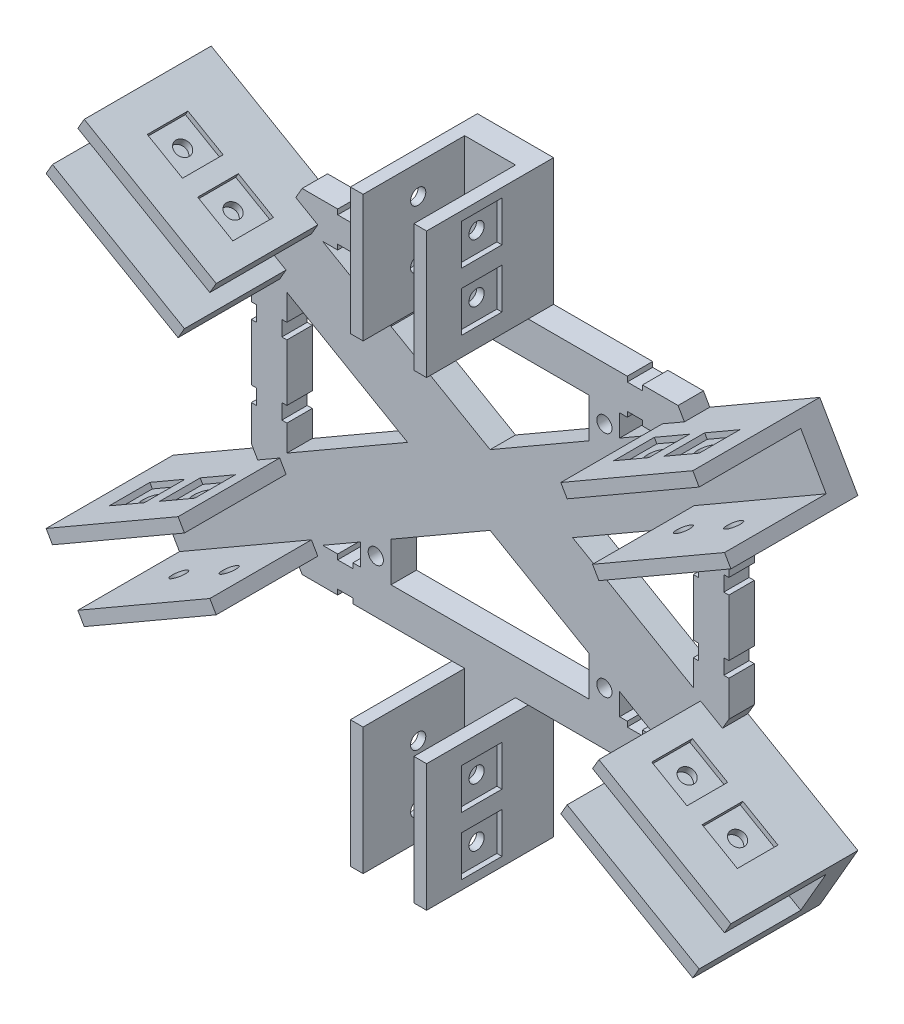
from build123d import *

# Parameters (mm, degrees)
ESQUISSE1_R                = 1.5
BOSS_EXTRU_2_DEPTH         = 5
ENL_V_MAT_EXTRU_2_DEPTH    = 2
ESQUISSE5_W                = 20
ESQUISSE5_H                = 2.5
BOSS_EXTRU_3_DEPTH         = 30
ESQUISSE7_W                = 20
ESQUISSE7_H                = 2.5
BOSS_EXTRU_4_DEPTH         = 30
ESQUISSE8_W                = 8
ESQUISSE8_H                = 8
ENL_V_MAT_EXTRU_3_DEPTH    = 1
ESQUISSE9_W                = 8
ESQUISSE9_H                = 8
ENL_V_MAT_EXTRU_4_DEPTH    = 1
ESQUISSE10_R               = 1.5
ENL_V_MAT_EXTRU_5_DEPTH    = 3
SYM_TRIE5_COPY_1_SKETCH_R  = 1.5
SYM_TRIE5_COPY_1_DEPTH     = 3
SYM_TRIE7_COPY_1_SKETCH_R  = 1.5
SYM_TRIE7_COPY_1_DEPTH     = 3
SYM_TRIE7_COPY_2_SKETCH_W  = 8
SYM_TRIE7_COPY_2_SKETCH_H  = 8
SYM_TRIE7_COPY_2_DEPTH     = 1
SYM_TRIE7_COPY_3_SKETCH_W  = 8
SYM_TRIE7_COPY_3_SKETCH_H  = 8
SYM_TRIE7_COPY_3_DEPTH     = 1
SYM_TRIE7_COPY_4_SKETCH_R  = 1.5
SYM_TRIE7_COPY_4_DEPTH     = 3
SYM_TRIE7_COPY_5_SKETCH_R  = 1.5
SYM_TRIE7_COPY_5_DEPTH     = 3
SYM_TRIE8_COPY_1_SKETCH_R  = 1.5
SYM_TRIE8_COPY_1_DEPTH     = 3
SYM_TRIE8_COPY_2_SKETCH_W  = 8
SYM_TRIE8_COPY_2_SKETCH_H  = 8
SYM_TRIE8_COPY_2_DEPTH     = 1
SYM_TRIE8_COPY_3_SKETCH_W  = 8
SYM_TRIE8_COPY_3_SKETCH_H  = 8
SYM_TRIE8_COPY_3_DEPTH     = 1
SYM_TRIE8_COPY_4_SKETCH_R  = 1.5
SYM_TRIE8_COPY_4_DEPTH     = 3
SYM_TRIE8_COPY_5_SKETCH_R  = 1.5
SYM_TRIE8_COPY_5_DEPTH     = 3
SYM_TRIE8_COPY_6_SKETCH_W  = 20
SYM_TRIE8_COPY_6_SKETCH_H  = 2.5
SYM_TRIE8_COPY_6_DEPTH     = 30
SYM_TRIE8_COPY_7_SKETCH_W  = 20
SYM_TRIE8_COPY_7_SKETCH_H  = 2.5
SYM_TRIE8_COPY_7_DEPTH     = 30
SYM_TRIE8_COPY_8_SKETCH_W  = 8
SYM_TRIE8_COPY_8_SKETCH_H  = 8
SYM_TRIE8_COPY_8_DEPTH     = 1
SYM_TRIE8_COPY_9_SKETCH_W  = 8
SYM_TRIE8_COPY_9_SKETCH_H  = 8
SYM_TRIE8_COPY_9_DEPTH     = 1
SYM_TRIE8_COPY_10_SKETCH_R = 1.5
SYM_TRIE8_COPY_10_DEPTH    = 3
SYM_TRIE8_COPY_11_SKETCH_R = 1.5
SYM_TRIE8_COPY_11_DEPTH    = 3
SYM_TRIE8_COPY_12_SKETCH_W = 8
SYM_TRIE8_COPY_12_SKETCH_H = 8
SYM_TRIE8_COPY_12_DEPTH    = 1
SYM_TRIE8_COPY_13_SKETCH_W = 8
SYM_TRIE8_COPY_13_SKETCH_H = 8
SYM_TRIE8_COPY_13_DEPTH    = 1
SYM_TRIE8_COPY_14_SKETCH_R = 1.5
SYM_TRIE8_COPY_14_DEPTH    = 3
SYM_TRIE8_COPY_15_SKETCH_R = 1.5
SYM_TRIE8_COPY_15_DEPTH    = 3
ESQUISSE11_W               = 2.5
ESQUISSE11_H               = 20
BOSS_EXTRU_5_DEPTH         = 25
ESQUISSE50_W               = 8
ESQUISSE50_H               = 8
ENL_V_MAT_EXTRU_25_DEPTH   = 1
ESQUISSE52_W               = 8
ESQUISSE52_H               = 8
ENL_V_MAT_EXTRU_26_DEPTH   = 1
ESQUISSE54_R               = 1.5
ENL_V_MAT_EXTRU_27_DEPTH   = 3
SYM_TRIE10_COPY_1_SKETCH_R = 1.5
SYM_TRIE10_COPY_1_DEPTH    = 3
SYM_TRIE11_COPY_1_SKETCH_R = 1.5
SYM_TRIE11_COPY_1_DEPTH    = 3
SYM_TRIE11_COPY_2_SKETCH_W = 2.5
SYM_TRIE11_COPY_2_SKETCH_H = 20
SYM_TRIE11_COPY_2_DEPTH    = 25
SYM_TRIE11_COPY_3_SKETCH_W = 8
SYM_TRIE11_COPY_3_SKETCH_H = 8
SYM_TRIE11_COPY_3_DEPTH    = 1
SYM_TRIE11_COPY_4_SKETCH_W = 8
SYM_TRIE11_COPY_4_SKETCH_H = 8
SYM_TRIE11_COPY_4_DEPTH    = 1
SYM_TRIE11_COPY_5_SKETCH_R = 1.5
SYM_TRIE11_COPY_5_DEPTH    = 3
SYM_TRIE11_COPY_6_SKETCH_R = 1.5
SYM_TRIE11_COPY_6_DEPTH    = 3


with BuildPart() as part:
    # Esquisse1 → Boss.-Extru.2 (new body)
    with BuildSketch(Plane.XY):
        Polygon((-27, -32.908965344), (-27, -31.908965344), (-30, -31.908965344), (-30, -32.908965344), (-37, -32.908965344), (-38.250062729, -30.743793185), (-59.900697824, -43.243793185), (-67.400697824, -30.253412128), (-45.750062729, -17.753412128), (-47, -15.588457268), (-47, -8.588457268), (-46, -8.588457268), (-46, -5.588457268), (-47, -5.588457268), (-47, 5.588457268), (-46, 5.588457268), (-46, 8.588457268), (-47, 8.588457268), (-47, 15.588457268), (-45.750062729, 17.753412128), (-67.400697824, 30.253412128), (-59.900697824, 43.243793185), (-38.250062729, 30.743793185), (-37, 32.908965344), (-30, 32.908965344), (-30, 31.908965344), (-27, 31.908965344), (-27, 32.908965344), (-7.5, 32.908965344), (-7.5, 57.908965344), (7.5, 57.908965344), (7.5, 32.908965344), (27, 32.908965344), (27, 31.908965344), (30, 31.908965344), (30, 32.908965344), (37, 32.908965344), (38.250062729, 30.743793185), (59.900697824, 43.243793185), (67.400697824, 30.253412128), (45.750062729, 17.753412128), (47, 15.588457268), (47, 8.588457268), (46, 8.588457268), (46, 5.588457268), (47, 5.588457268), (47, -5.588457268), (46, -5.588457268), (46, -8.588457268), (47, -8.588457268), (47, -15.588457268), (45.750062729, -17.753412128), (67.400697824, -30.253412128), (59.900697824, -43.243793185), (38.250062729, -30.743793185), (37, -32.908965344), (30, -32.908965344), (30, -31.908965344), (27, -31.908965344), (27, -32.908965344), (7.5, -32.908965344), (7.5, -57.908965344), (-7.5, -57.908965344), (-7.5, -32.908965344), align=None)
        with Locations((22.5, 22.5)):
            Circle(ESQUISSE1_R, mode=Mode.SUBTRACT)
        with Locations((-22.5, 22.5)):
            Circle(ESQUISSE1_R, mode=Mode.SUBTRACT)
        with Locations((22.5, -22.5)):
            Circle(ESQUISSE1_R, mode=Mode.SUBTRACT)
        with Locations((-22.5, -22.5)):
            Circle(ESQUISSE1_R, mode=Mode.SUBTRACT)
        Polygon((-40, 5.588457268), (-40, -5.588457268), (-41, -5.588457268), (-41, -8.588457268), (-40, -8.588457268), (-40, -13.712812921), (-16.248711306, 0), (-40, 13.712812921), (-40, 8.588457268), (-41, 8.588457268), (-41, 5.588457268), align=None, mode=Mode.SUBTRACT)
        Polygon((40, 13.712812921), (16.248711306, 0), (40, -13.712812921), (40, -8.588457268), (41, -8.588457268), (41, -5.588457268), (40, -5.588457268), (40, 5.588457268), (41, 5.588457268), (41, 8.588457268), (40, 8.588457268), align=None, mode=Mode.SUBTRACT)
        Polygon((-32.958548116, -25.908965344), (-30, -25.908965344), (-30, -26.908965344), (-27, -26.908965344), (-27, -25.908965344), (-25.5, -25.908965344), (-25.5, -21.602770581), align=None, mode=Mode.SUBTRACT)
        Polygon((19.5, -25.908965344), (0, -25.908965344), (-19.5, -25.908965344), (-19.5, -18.138668966), (0, -6.880338717), (19.5, -18.138668966), align=None, mode=Mode.SUBTRACT)
        Polygon((-27, 26.908965344), (-27, 25.908965344), (-25.5, 25.908965344), (-25.5, 21.602770581), (-32.958548116, 25.908965344), (-30, 25.908965344), (-30, 26.908965344), align=None, mode=Mode.SUBTRACT)
        Polygon((32.958548116, 25.908965344), (25.5, 21.602770581), (25.5, 25.908965344), (27, 25.908965344), (27, 26.908965344), (30, 26.908965344), (30, 25.908965344), align=None, mode=Mode.SUBTRACT)
        Polygon((27, -26.908965344), (27, -25.908965344), (25.5, -25.908965344), (25.5, -21.602770581), (32.958548116, -25.908965344), (30, -25.908965344), (30, -26.908965344), align=None, mode=Mode.SUBTRACT)
        Polygon((-19.5, 25.908965344), (-19.5, 18.138668966), (0, 6.880338717), (19.5, 18.138668966), (19.5, 25.908965344), (0, 25.908965344), align=None, mode=Mode.SUBTRACT)
    extrude(amount=BOSS_EXTRU_2_DEPTH)

    # Esquisse4 → Enlèv. mat.-Extru.2 (cut)
    with BuildSketch(Plane(origin=(0, 0, 0), x_dir=(-1, 0, 0), z_dir=(0, 0, -1))):
        Polygon((-22.5, 20.142891012), (-20.458683737, 21.321445506), (-20.458683737, 23.678554494), (-22.5, 24.857108988), (-24.541316263, 23.678554494), (-24.541316263, 21.321445506), align=None)
        Polygon((24.541316263, 21.321445506), (22.5, 20.142891012), (20.458683737, 21.321445506), (20.458683737, 23.678554494), (22.5, 24.857108988), (24.541316263, 23.678554494), align=None)
        Polygon((22.5, -20.142891012), (20.458683737, -21.321445506), (20.458683737, -23.678554494), (22.5, -24.857108988), (24.541316263, -23.678554494), (24.541316263, -21.321445506), align=None)
        Polygon((-24.541316263, -21.321445506), (-22.5, -20.142891012), (-20.458683737, -21.321445506), (-20.458683737, -23.678554494), (-22.5, -24.857108988), (-24.541316263, -23.678554494), align=None)
    extrude(amount=-ENL_V_MAT_EXTRU_2_DEPTH, mode=Mode.SUBTRACT)

    # Esquisse5 → Boss.-Extru.3 (add)
    with BuildSketch(Plane(origin=(63.650635095, 36.748711306, 0), x_dir=(0, 0, -1), z_dir=(0.8660254037844382, 0.500000000000001, 0))):
        with Locations((-15, -6.250125458)):
            Rectangle(ESQUISSE5_W, ESQUISSE5_H)
    boss_extru_3 = extrude(amount=-BOSS_EXTRU_3_DEPTH)

    # Esquisse7 → Boss.-Extru.4 (add)
    with BuildSketch(Plane(origin=(63.650635095, 36.748711306, 0), x_dir=(0, 0, -1), z_dir=(0.866025403784438, 0.5000000000000009, 0))):
        with Locations((-15, 6.249874542)):
            Rectangle(ESQUISSE7_W, ESQUISSE7_H)
    boss_extru_4 = extrude(amount=-BOSS_EXTRU_4_DEPTH)

    # Esquisse8 → Enlèv. mat.-Extru.3 (cut)
    with BuildSketch(Plane(origin=(3.750062729, -6.495299178, 0), x_dir=(0.8660254037844448, 0.4999999999999891, 0), z_dir=(0.4999999999999892, -0.8660254037844449, 0))):
        with Locations((51.610954886, 14.155470703)):
            Rectangle(ESQUISSE8_W, ESQUISSE8_H)
    enl_v_mat_extru_3 = extrude(amount=-ENL_V_MAT_EXTRU_3_DEPTH, mode=Mode.SUBTRACT)

    # Esquisse9 → Enlèv. mat.-Extru.4 (cut)
    with BuildSketch(Plane(origin=(3.750062729, -6.495299178, 0), x_dir=(0.8660254037844448, 0.4999999999999891, 0), z_dir=(0.4999999999999892, -0.8660254037844449, 0))):
        with Locations((63.062795122, 14.155470703)):
            Rectangle(ESQUISSE9_W, ESQUISSE9_H)
    enl_v_mat_extru_4 = extrude(amount=-ENL_V_MAT_EXTRU_4_DEPTH, mode=Mode.SUBTRACT)

    # Esquisse10 → Enlèv. mat.-Extru.5 (cut)
    with BuildSketch(Plane(origin=(3.250062729, -5.629273774, 0), x_dir=(0.8660254037844448, 0.49999999999998934, 0), z_dir=(0.4999999999999894, -0.8660254037844449, 0))):
        with Locations((51.610954886, 14.155470703)):
            Circle(ESQUISSE10_R)
    enl_v_mat_extru_5 = extrude(amount=-ENL_V_MAT_EXTRU_5_DEPTH, mode=Mode.SUBTRACT)

    # Symétrie4: Enlèv. mat.-Extru.5 across plane
    add(enl_v_mat_extru_5.mirror(Plane(origin=(49.655190327, 28.668437502, 0), x_dir=(0, 0, 1), z_dir=(-0.8660254037844448, -0.4999999999999891, 0))), mode=Mode.SUBTRACT)

    # Symétrie5: Enlèv. mat.-Extru.3, Enlèv. mat.-Extru.4, Enlèv. mat.-Extru.5 across plane
    add(enl_v_mat_extru_3.mirror(Plane(origin=(6.2729e-05, -0.00010865, 0), x_dir=(0, 0, 1), z_dir=(-0.5000000000000009, 0.8660254037844383, 0))), mode=Mode.SUBTRACT)
    add(enl_v_mat_extru_4.mirror(Plane(origin=(6.2729e-05, -0.00010865, 0), x_dir=(0, 0, 1), z_dir=(-0.5000000000000009, 0.8660254037844383, 0))), mode=Mode.SUBTRACT)
    add(enl_v_mat_extru_5.mirror(Plane(origin=(6.2729e-05, -0.00010865, 0), x_dir=(0, 0, 1), z_dir=(-0.5000000000000009, 0.8660254037844383, 0))), mode=Mode.SUBTRACT)

    # Symétrie5 copy 1 sketch → Symétrie5 copy 1 (cut)
    with BuildSketch(Plane(origin=(96.060443383, 62.965931479, 0), x_dir=(-0.8660254037844315, -0.5000000000000128, 1.001543065824766e-15), z_dir=(-0.500000000000013, 0.8660254037844318, 0))):
        with Locations((51.610954886, 14.155470703)):
            Circle(SYM_TRIE5_COPY_1_SKETCH_R)
    extrude(amount=-SYM_TRIE5_COPY_1_DEPTH, mode=Mode.SUBTRACT)

    # Symétrie7: Boss.-Extru.3, Boss.-Extru.4, Enlèv. mat.-Extru.3, Enlèv. mat.-Extru.4, Enlèv. mat.-Extru.5 across plane
    add(boss_extru_3.mirror(Plane.ZX))
    add(boss_extru_4.mirror(Plane.ZX))
    add(enl_v_mat_extru_3.mirror(Plane.ZX), mode=Mode.SUBTRACT)
    add(enl_v_mat_extru_4.mirror(Plane.ZX), mode=Mode.SUBTRACT)
    add(enl_v_mat_extru_5.mirror(Plane.ZX), mode=Mode.SUBTRACT)

    # Symétrie7 copy 1 sketch → Symétrie7 copy 1 (cut)
    with BuildSketch(Plane(origin=(102.560443383, -51.70760123, 0), x_dir=(-0.866025403784445, 0.49999999999998906, 1.001543065824766e-15), z_dir=(0.4999999999999891, 0.8660254037844451, 0))):
        with Locations((51.610954886, 14.155470703)):
            Circle(SYM_TRIE7_COPY_1_SKETCH_R)
    extrude(amount=-SYM_TRIE7_COPY_1_DEPTH, mode=Mode.SUBTRACT)

    # Symétrie7 copy 2 sketch → Symétrie7 copy 2 (cut)
    with BuildSketch(Plane(origin=(-3.749937271, -6.495081879, 0), x_dir=(0.8660254037844313, -0.5000000000000124, 0), z_dir=(-0.5000000000000128, -0.8660254037844318, 0))):
        with Locations((51.610954886, 14.155470703)):
            Rectangle(SYM_TRIE7_COPY_2_SKETCH_W, SYM_TRIE7_COPY_2_SKETCH_H)
    extrude(amount=-SYM_TRIE7_COPY_2_DEPTH, mode=Mode.SUBTRACT)

    # Symétrie7 copy 3 sketch → Symétrie7 copy 3 (cut)
    with BuildSketch(Plane(origin=(-3.749937271, -6.495081879, 0), x_dir=(0.8660254037844313, -0.5000000000000124, 0), z_dir=(-0.5000000000000128, -0.8660254037844318, 0))):
        with Locations((63.062795122, 14.155470703)):
            Rectangle(SYM_TRIE7_COPY_3_SKETCH_W, SYM_TRIE7_COPY_3_SKETCH_H)
    extrude(amount=-SYM_TRIE7_COPY_3_DEPTH, mode=Mode.SUBTRACT)

    # Symétrie7 copy 4 sketch → Symétrie7 copy 4 (cut)
    with BuildSketch(Plane(origin=(-3.249937271, -5.629056475, 0), x_dir=(0.8660254037844315, -0.5000000000000123, 0), z_dir=(-0.5000000000000127, -0.866025403784432, 0))):
        with Locations((51.610954886, 14.155470703)):
            Circle(SYM_TRIE7_COPY_4_SKETCH_R)
    extrude(amount=-SYM_TRIE7_COPY_4_DEPTH, mode=Mode.SUBTRACT)

    # Symétrie7 copy 5 sketch → Symétrie7 copy 5 (cut)
    with BuildSketch(Plane(origin=(96.060443383, -62.965931479, 0), x_dir=(-0.8660254037844315, 0.5000000000000128, 1.001543065824766e-15), z_dir=(-0.500000000000013, -0.8660254037844318, 0))):
        with Locations((51.610954886, -14.155470703)):
            Circle(SYM_TRIE7_COPY_5_SKETCH_R)
    extrude(amount=-SYM_TRIE7_COPY_5_DEPTH, mode=Mode.SUBTRACT)

    # Symétrie8: Boss.-Extru.3, Boss.-Extru.4, Enlèv. mat.-Extru.3, Enlèv. mat.-Extru.4, Enlèv. mat.-Extru.5 across plane
    add(boss_extru_3.mirror(Plane(origin=(0, 0, 0), x_dir=(0, 0, 1), z_dir=(1, 0, 0))))
    add(boss_extru_4.mirror(Plane(origin=(0, 0, 0), x_dir=(0, 0, 1), z_dir=(1, 0, 0))))
    add(enl_v_mat_extru_3.mirror(Plane(origin=(0, 0, 0), x_dir=(0, 0, 1), z_dir=(1, 0, 0))), mode=Mode.SUBTRACT)
    add(enl_v_mat_extru_4.mirror(Plane(origin=(0, 0, 0), x_dir=(0, 0, 1), z_dir=(1, 0, 0))), mode=Mode.SUBTRACT)
    add(enl_v_mat_extru_5.mirror(Plane(origin=(0, 0, 0), x_dir=(0, 0, 1), z_dir=(1, 0, 0))), mode=Mode.SUBTRACT)

    # Symétrie8 copy 1 sketch → Symétrie8 copy 1 (cut)
    with BuildSketch(Plane(origin=(-102.560443383, 51.70760123, 0), x_dir=(0.866025403784445, -0.49999999999998906, 1.001543065824766e-15), z_dir=(-0.4999999999999891, -0.8660254037844451, 0))):
        with Locations((51.610954886, 14.155470703)):
            Circle(SYM_TRIE8_COPY_1_SKETCH_R)
    extrude(amount=-SYM_TRIE8_COPY_1_DEPTH, mode=Mode.SUBTRACT)

    # Symétrie8 copy 2 sketch → Symétrie8 copy 2 (cut)
    with BuildSketch(Plane(origin=(3.749937271, 6.495081879, 0), x_dir=(-0.8660254037844313, 0.5000000000000124, 0), z_dir=(0.5000000000000128, 0.8660254037844318, 0))):
        with Locations((51.610954886, 14.155470703)):
            Rectangle(SYM_TRIE8_COPY_2_SKETCH_W, SYM_TRIE8_COPY_2_SKETCH_H)
    extrude(amount=-SYM_TRIE8_COPY_2_DEPTH, mode=Mode.SUBTRACT)

    # Symétrie8 copy 3 sketch → Symétrie8 copy 3 (cut)
    with BuildSketch(Plane(origin=(3.749937271, 6.495081879, 0), x_dir=(-0.8660254037844313, 0.5000000000000124, 0), z_dir=(0.5000000000000128, 0.8660254037844318, 0))):
        with Locations((63.062795122, 14.155470703)):
            Rectangle(SYM_TRIE8_COPY_3_SKETCH_W, SYM_TRIE8_COPY_3_SKETCH_H)
    extrude(amount=-SYM_TRIE8_COPY_3_DEPTH, mode=Mode.SUBTRACT)

    # Symétrie8 copy 4 sketch → Symétrie8 copy 4 (cut)
    with BuildSketch(Plane(origin=(3.249937271, 5.629056475, 0), x_dir=(-0.8660254037844315, 0.5000000000000123, 0), z_dir=(0.5000000000000127, 0.866025403784432, 0))):
        with Locations((51.610954886, 14.155470703)):
            Circle(SYM_TRIE8_COPY_4_SKETCH_R)
    extrude(amount=-SYM_TRIE8_COPY_4_DEPTH, mode=Mode.SUBTRACT)

    # Symétrie8 copy 5 sketch → Symétrie8 copy 5 (cut)
    with BuildSketch(Plane(origin=(-96.060443383, 62.965931479, 0), x_dir=(0.8660254037844315, -0.5000000000000128, 1.001543065824766e-15), z_dir=(0.500000000000013, 0.8660254037844318, 0))):
        with Locations((51.610954886, -14.155470703)):
            Circle(SYM_TRIE8_COPY_5_SKETCH_R)
    extrude(amount=-SYM_TRIE8_COPY_5_DEPTH, mode=Mode.SUBTRACT)

    # Symétrie8 copy 6 sketch → Symétrie8 copy 6 (add)
    with BuildSketch(Plane(origin=(-63.650635095, -36.748711306, 0), x_dir=(0, 0, -1), z_dir=(-0.8660254037844382, -0.500000000000001, 0))):
        with Locations((-15, -6.250125458)):
            Rectangle(SYM_TRIE8_COPY_6_SKETCH_W, SYM_TRIE8_COPY_6_SKETCH_H)
    extrude(amount=-SYM_TRIE8_COPY_6_DEPTH)

    # Symétrie8 copy 7 sketch → Symétrie8 copy 7 (add)
    with BuildSketch(Plane(origin=(-63.650635095, -36.748711306, 0), x_dir=(0, 0, -1), z_dir=(-0.866025403784438, -0.5000000000000009, 0))):
        with Locations((-15, 6.249874542)):
            Rectangle(SYM_TRIE8_COPY_7_SKETCH_W, SYM_TRIE8_COPY_7_SKETCH_H)
    extrude(amount=-SYM_TRIE8_COPY_7_DEPTH)

    # Symétrie8 copy 8 sketch → Symétrie8 copy 8 (cut)
    with BuildSketch(Plane(origin=(-3.750062729, 6.495299178, 0), x_dir=(-0.8660254037844448, -0.4999999999999891, 0), z_dir=(-0.4999999999999892, 0.8660254037844449, 0))):
        with Locations((51.610954886, 14.155470703)):
            Rectangle(SYM_TRIE8_COPY_8_SKETCH_W, SYM_TRIE8_COPY_8_SKETCH_H)
    extrude(amount=-SYM_TRIE8_COPY_8_DEPTH, mode=Mode.SUBTRACT)

    # Symétrie8 copy 9 sketch → Symétrie8 copy 9 (cut)
    with BuildSketch(Plane(origin=(-3.750062729, 6.495299178, 0), x_dir=(-0.8660254037844448, -0.4999999999999891, 0), z_dir=(-0.4999999999999892, 0.8660254037844449, 0))):
        with Locations((63.062795122, 14.155470703)):
            Rectangle(SYM_TRIE8_COPY_9_SKETCH_W, SYM_TRIE8_COPY_9_SKETCH_H)
    extrude(amount=-SYM_TRIE8_COPY_9_DEPTH, mode=Mode.SUBTRACT)

    # Symétrie8 copy 10 sketch → Symétrie8 copy 10 (cut)
    with BuildSketch(Plane(origin=(-3.250062729, 5.629273774, 0), x_dir=(-0.8660254037844448, -0.49999999999998934, 0), z_dir=(-0.4999999999999894, 0.8660254037844449, 0))):
        with Locations((51.610954886, 14.155470703)):
            Circle(SYM_TRIE8_COPY_10_SKETCH_R)
    extrude(amount=-SYM_TRIE8_COPY_10_DEPTH, mode=Mode.SUBTRACT)

    # Symétrie8 copy 11 sketch → Symétrie8 copy 11 (cut)
    with BuildSketch(Plane(origin=(-102.560443383, -51.70760123, 0), x_dir=(0.866025403784445, 0.49999999999998906, 1.001543065824766e-15), z_dir=(-0.4999999999999891, 0.8660254037844451, 0))):
        with Locations((51.610954886, -14.155470703)):
            Circle(SYM_TRIE8_COPY_11_SKETCH_R)
    extrude(amount=-SYM_TRIE8_COPY_11_DEPTH, mode=Mode.SUBTRACT)

    # Symétrie8 copy 12 sketch → Symétrie8 copy 12 (cut)
    with BuildSketch(Plane(origin=(3.749937271, -6.495081879, 0), x_dir=(-0.8660254037844313, -0.5000000000000124, 0), z_dir=(0.5000000000000128, -0.8660254037844318, 0))):
        with Locations((51.610954886, -14.155470703)):
            Rectangle(SYM_TRIE8_COPY_12_SKETCH_W, SYM_TRIE8_COPY_12_SKETCH_H)
    extrude(amount=-SYM_TRIE8_COPY_12_DEPTH, mode=Mode.SUBTRACT)

    # Symétrie8 copy 13 sketch → Symétrie8 copy 13 (cut)
    with BuildSketch(Plane(origin=(3.749937271, -6.495081879, 0), x_dir=(-0.8660254037844313, -0.5000000000000124, 0), z_dir=(0.5000000000000128, -0.8660254037844318, 0))):
        with Locations((63.062795122, -14.155470703)):
            Rectangle(SYM_TRIE8_COPY_13_SKETCH_W, SYM_TRIE8_COPY_13_SKETCH_H)
    extrude(amount=-SYM_TRIE8_COPY_13_DEPTH, mode=Mode.SUBTRACT)

    # Symétrie8 copy 14 sketch → Symétrie8 copy 14 (cut)
    with BuildSketch(Plane(origin=(3.249937271, -5.629056475, 0), x_dir=(-0.8660254037844315, -0.5000000000000123, 0), z_dir=(0.5000000000000127, -0.866025403784432, 0))):
        with Locations((51.610954886, -14.155470703)):
            Circle(SYM_TRIE8_COPY_14_SKETCH_R)
    extrude(amount=-SYM_TRIE8_COPY_14_DEPTH, mode=Mode.SUBTRACT)

    # Symétrie8 copy 15 sketch → Symétrie8 copy 15 (cut)
    with BuildSketch(Plane(origin=(-96.060443383, -62.965931479, 0), x_dir=(0.8660254037844315, 0.5000000000000128, 1.001543065824766e-15), z_dir=(0.500000000000013, -0.8660254037844318, 0))):
        with Locations((51.610954886, 14.155470703)):
            Circle(SYM_TRIE8_COPY_15_SKETCH_R)
    extrude(amount=-SYM_TRIE8_COPY_15_DEPTH, mode=Mode.SUBTRACT)

    # Esquisse11 → Boss.-Extru.5 (add)
    with BuildSketch(Plane(origin=(0, 57.908965344, 0), x_dir=(1, 0, 0), z_dir=(0, 1, 0))):
        with Locations((-6.25, -15)):
            Rectangle(ESQUISSE11_W, ESQUISSE11_H)
    boss_extru_5 = extrude(amount=-BOSS_EXTRU_5_DEPTH)

    # Esquisse50 → Enlèv. mat.-Extru.25 (cut)
    with BuildSketch(Plane(origin=(-7.5, 26.517737728, -42.965253421), x_dir=(0, 0, 1), z_dir=(-1, 0, 0))):
        with Locations((57.125253421, 14.155470703)):
            Rectangle(ESQUISSE50_W, ESQUISSE50_H)
    enl_v_mat_extru_25 = extrude(amount=-ENL_V_MAT_EXTRU_25_DEPTH, mode=Mode.SUBTRACT)

    # Esquisse52 → Enlèv. mat.-Extru.26 (cut)
    with BuildSketch(Plane(origin=(-7.5, 26.517737728, -42.965253421), x_dir=(0, 0, 1), z_dir=(-1, 0, 0))):
        with Locations((57.125253421, 25.605470703)):
            Rectangle(ESQUISSE52_W, ESQUISSE52_H)
    enl_v_mat_extru_26 = extrude(amount=-ENL_V_MAT_EXTRU_26_DEPTH, mode=Mode.SUBTRACT)

    # Esquisse54 → Enlèv. mat.-Extru.27 (cut)
    with BuildSketch(Plane(origin=(-6.5, 26.517737728, -42.965253421), x_dir=(0, 0, 1), z_dir=(-1, 0, 0))):
        with Locations((57.125253421, 14.155470703)):
            Circle(ESQUISSE54_R)
    enl_v_mat_extru_27 = extrude(amount=-ENL_V_MAT_EXTRU_27_DEPTH, mode=Mode.SUBTRACT)

    # Symétrie9: Enlèv. mat.-Extru.27 across plane
    add(enl_v_mat_extru_27.mirror(Plane.ZX.offset(46.398208431)), mode=Mode.SUBTRACT)

    # Symétrie10: Boss.-Extru.5, Enlèv. mat.-Extru.25, Enlèv. mat.-Extru.26, Enlèv. mat.-Extru.27 across plane
    add(boss_extru_5.mirror(Plane.ZY))
    add(enl_v_mat_extru_25.mirror(Plane.ZY), mode=Mode.SUBTRACT)
    add(enl_v_mat_extru_26.mirror(Plane.ZY), mode=Mode.SUBTRACT)
    add(enl_v_mat_extru_27.mirror(Plane.ZY), mode=Mode.SUBTRACT)

    # Symétrie10 copy 1 sketch → Symétrie10 copy 1 (cut)
    with BuildSketch(Plane(origin=(6.5, 66.278679134, -42.965253421), x_dir=(0, 0, 1), z_dir=(1, 0, 0))):
        with Locations((57.125253421, 14.155470703)):
            Circle(SYM_TRIE10_COPY_1_SKETCH_R)
    extrude(amount=-SYM_TRIE10_COPY_1_DEPTH, mode=Mode.SUBTRACT)

    # Symétrie11: Boss.-Extru.5, Enlèv. mat.-Extru.25, Enlèv. mat.-Extru.26, Enlèv. mat.-Extru.27 across plane
    add(boss_extru_5.mirror(Plane.ZX))
    add(enl_v_mat_extru_25.mirror(Plane.ZX), mode=Mode.SUBTRACT)
    add(enl_v_mat_extru_26.mirror(Plane.ZX), mode=Mode.SUBTRACT)
    add(enl_v_mat_extru_27.mirror(Plane.ZX), mode=Mode.SUBTRACT)

    # Symétrie11 copy 1 sketch → Symétrie11 copy 1 (cut)
    with BuildSketch(Plane(origin=(-6.5, -66.278679134, -42.965253421), x_dir=(0, 0, 1), z_dir=(-1, 0, 0))):
        with Locations((57.125253421, 14.155470703)):
            Circle(SYM_TRIE11_COPY_1_SKETCH_R)
    extrude(amount=-SYM_TRIE11_COPY_1_DEPTH, mode=Mode.SUBTRACT)

    # Symétrie11 copy 2 sketch → Symétrie11 copy 2 (add)
    with BuildSketch(Plane(origin=(0, -57.908965344, 0), x_dir=(-1, 0, 0), z_dir=(0, -1, 0))):
        with Locations((-6.25, -15)):
            Rectangle(SYM_TRIE11_COPY_2_SKETCH_W, SYM_TRIE11_COPY_2_SKETCH_H)
    extrude(amount=-SYM_TRIE11_COPY_2_DEPTH)

    # Symétrie11 copy 3 sketch → Symétrie11 copy 3 (cut)
    with BuildSketch(Plane(origin=(7.5, -26.517737728, -42.965253421), x_dir=(0, 0, 1), z_dir=(1, 0, 0))):
        with Locations((57.125253421, 14.155470703)):
            Rectangle(SYM_TRIE11_COPY_3_SKETCH_W, SYM_TRIE11_COPY_3_SKETCH_H)
    extrude(amount=-SYM_TRIE11_COPY_3_DEPTH, mode=Mode.SUBTRACT)

    # Symétrie11 copy 4 sketch → Symétrie11 copy 4 (cut)
    with BuildSketch(Plane(origin=(7.5, -26.517737728, -42.965253421), x_dir=(0, 0, 1), z_dir=(1, 0, 0))):
        with Locations((57.125253421, 25.605470703)):
            Rectangle(SYM_TRIE11_COPY_4_SKETCH_W, SYM_TRIE11_COPY_4_SKETCH_H)
    extrude(amount=-SYM_TRIE11_COPY_4_DEPTH, mode=Mode.SUBTRACT)

    # Symétrie11 copy 5 sketch → Symétrie11 copy 5 (cut)
    with BuildSketch(Plane(origin=(6.5, -26.517737728, -42.965253421), x_dir=(0, 0, 1), z_dir=(1, 0, 0))):
        with Locations((57.125253421, 14.155470703)):
            Circle(SYM_TRIE11_COPY_5_SKETCH_R)
    extrude(amount=-SYM_TRIE11_COPY_5_DEPTH, mode=Mode.SUBTRACT)

    # Symétrie11 copy 6 sketch → Symétrie11 copy 6 (cut)
    with BuildSketch(Plane(origin=(6.5, -66.278679134, -42.965253421), x_dir=(0, 0, 1), z_dir=(1, 0, 0))):
        with Locations((57.125253421, -14.155470703)):
            Circle(SYM_TRIE11_COPY_6_SKETCH_R)
    extrude(amount=-SYM_TRIE11_COPY_6_DEPTH, mode=Mode.SUBTRACT)


solid = part.part
